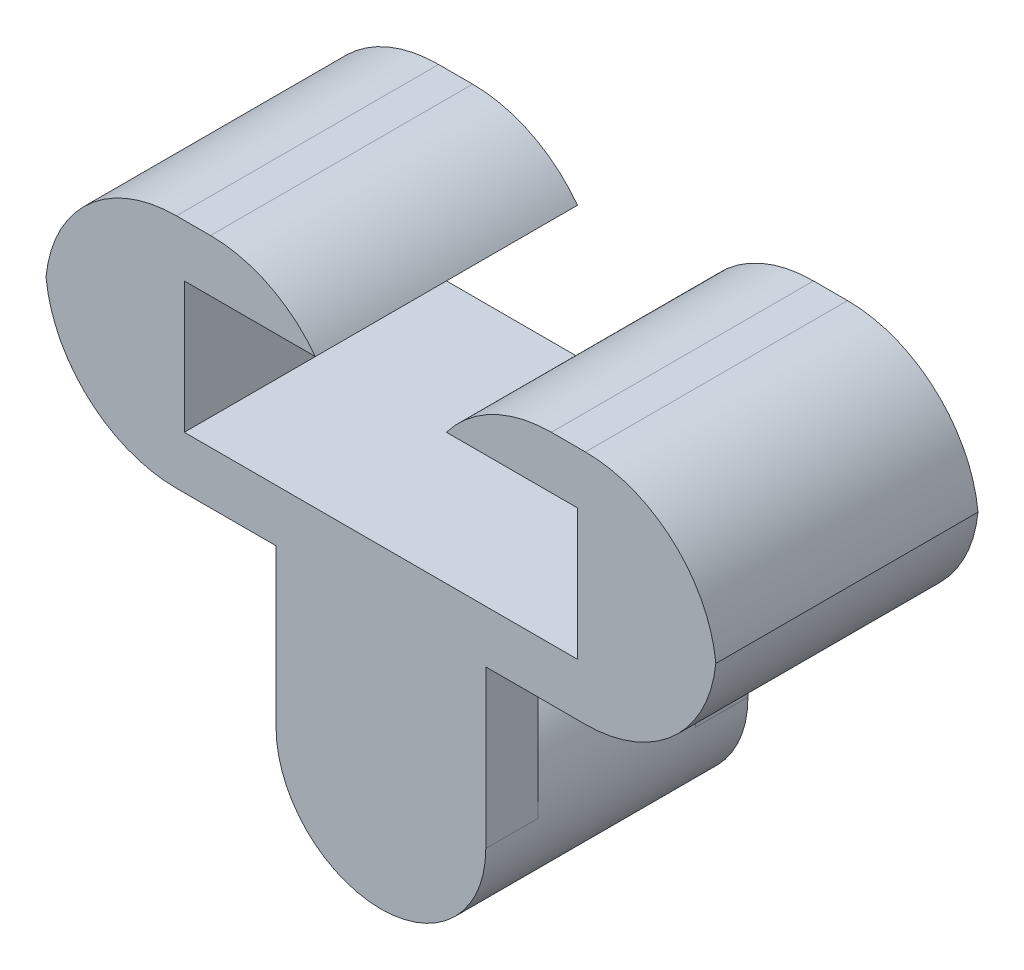
from build123d import *

# Parameters (mm, degrees)
BOSS_EXTRUDE2_DEPTH = 25.4
BOSS_EXTRUDE3_DEPTH = 7.62
SKETCH6_R           = 10.16
BOSS_EXTRUDE5_DEPTH = 25.4
FILLET4_R           = 12.7
CHAMFER3_SIZE       = 2.54
SKETCH7_W           = 20.32
SKETCH7_H           = 15.24
BOSS_EXTRUDE6_DEPTH = 7.62
CHAMFER4_SIZE       = 2.54


with BuildPart() as part:
    # Sketch2 → Boss-Extrude2 (new body)
    with BuildSketch(Plane.XY):
        Polygon((0, 0), (26.162, 0), (26.162, -5.08), (13.462, -5.08), (13.462, -17.78), (51.562, -17.78), (51.562, -5.08), (38.862, -5.08), (38.862, 0), (65.024, 0), (65.024, -22.86), (0, -22.86), align=None)
    extrude(amount=BOSS_EXTRUDE2_DEPTH)

    # Sketch4 → Boss-Extrude3 (add)
    with BuildSketch(Plane.XY.offset(25.4)):
        Polygon((32.512, -22.86), (22.352, -22.86), (22.352, -38.1), (42.672, -38.1), (42.672, -22.86), align=None)
    extrude(amount=-BOSS_EXTRUDE3_DEPTH)

    # Sketch6 → Boss-Extrude5 (add)
    with BuildSketch(Plane.XY.offset(25.4)):
        with Locations((32.512, -38.1)):
            Circle(SKETCH6_R)
    extrude(amount=-BOSS_EXTRUDE5_DEPTH)

    # Fillet4
    # the kernel refuses this fillet: 12.7 mm, written as the material it takes off along each edge
    with BuildSketch(Plane(origin=(65.024, -22.86, -31.75), x_dir=(-1, 0, 0), z_dir=(0, 0, 1)), Plane(origin=(0, -22.86, -31.75), x_dir=(0, 1, 0), z_dir=(0, 0, 1)), Plane(origin=(0, 0, -31.75), x_dir=(1, 0, 0), z_dir=(0, 0, 1))) as fillet4_piece_1:
        with BuildLine():
            CenterArc((FILLET4_R, -FILLET4_R), FILLET4_R, 90, 90)
            Line((0, -FILLET4_R), (-FILLET4_R * 0.02, -FILLET4_R))
            Line((-FILLET4_R * 0.02, -FILLET4_R), (-FILLET4_R * 0.02, FILLET4_R * 0.02))
            Line((-FILLET4_R * 0.02, FILLET4_R * 0.02), (FILLET4_R, FILLET4_R * 0.02))
            Line((FILLET4_R, FILLET4_R * 0.02), (FILLET4_R, 0))
        make_face()
    extrude(amount=88.9, mode=Mode.SUBTRACT)
    with BuildSketch(Plane(origin=(26.162, 0, -25.4), x_dir=(-1, 0, 0), z_dir=(0, 0, 1))) as fillet4_piece_2:
        with BuildLine():
            CenterArc((10.16, 12.7), FILLET4_R, 216.869897646, 53.130102354)
            Line((0, 5.08), (-0.2032, 4.9276))
            ThreePointArc((-0.2032, 4.9276), (-0.254, 2.54), (-0.254, 0))
            Line((-0.254, 0), (0, -0.254))
            Line((0, -0.254), (10.16, -0.254))
            Line((10.16, -0.254), (10.16, 0))
        make_face()
    extrude(amount=76.2, mode=Mode.SUBTRACT)
    with BuildSketch(Plane(origin=(38.862, 0, -25.4), x_dir=(0, -1, 0), z_dir=(0, 0, 1))) as fillet4_piece_3:
        with BuildLine():
            CenterArc((12.7, 10.16), FILLET4_R, 180, 53.130102354)
            Line((0, 10.16), (-0.254, 10.16))
            Line((-0.254, 10.16), (-0.254, 0))
            Line((-0.254, 0), (0, -0.254))
            ThreePointArc((0, -0.254), (2.54, -0.254), (4.9276, -0.2032))
            Line((4.9276, -0.2032), (5.08, 0))
        make_face()
    extrude(amount=76.2, mode=Mode.SUBTRACT)
    with BuildSketch(Plane(origin=(65.024, 0, -31.75), x_dir=(-1, 0, 0), z_dir=(0, 0, 1))) as fillet4_piece_4:
        with BuildLine():
            CenterArc((FILLET4_R, FILLET4_R), FILLET4_R, 180, 90)
            Line((0, FILLET4_R), (-FILLET4_R * 0.02, FILLET4_R))
            Line((-FILLET4_R * 0.02, FILLET4_R), (-FILLET4_R * 0.02, -FILLET4_R * 0.02))
            Line((-FILLET4_R * 0.02, -FILLET4_R * 0.02), (FILLET4_R, -FILLET4_R * 0.02))
            Line((FILLET4_R, -FILLET4_R * 0.02), (FILLET4_R, 0))
        make_face()
    extrude(amount=88.9, mode=Mode.SUBTRACT)

    # Chamfer3
    # the kernel refuses this chamfer: 2.54 mm, written as the material it takes off along each edge
    with BuildSketch(Plane(origin=(42.672, -44.632074789, 17.78), x_dir=(0.027495876610587302, 0, 0.9996219169112966), z_dir=(0, 1, 0))) as chamfer3_piece_1_section:
        Polygon((CHAMFER3_SIZE * 0.999621916911, -CHAMFER3_SIZE * 0.0274958766106), (-CHAMFER3_SIZE * 0.0274958766106, -CHAMFER3_SIZE * 0.999621916911), (0, 0), align=None)
    chamfer3_piece_1 = extrude(amount=21.772074789, mode=Mode.PRIVATE)
    chamfer3_piece_1 = chamfer3_piece_1 - Plane(origin=(32.512, -38.1, 18.664342035), x_dir=(1, 0, 0), z_dir=(0, 0, 1)) * Cylinder(10.16, 54, mode=Mode.PRIVATE)
    add(chamfer3_piece_1, mode=Mode.SUBTRACT)
    with BuildSketch(Plane(origin=(22.352, -22.86, 17.78), x_dir=(-0.02749587661058595, 0, 0.9996219169112968), z_dir=(0, -1, 0))) as chamfer3_piece_2_section:
        Polygon((CHAMFER3_SIZE * 0.999621916911, -CHAMFER3_SIZE * 0.0274958766106), (-CHAMFER3_SIZE * 0.0274958766106, -CHAMFER3_SIZE * 0.999621916911), (0, 0), align=None)
    chamfer3_piece_2 = extrude(amount=21.772074789, mode=Mode.PRIVATE)
    chamfer3_piece_2 = chamfer3_piece_2 - Plane(origin=(32.512, -38.1, 18.664342036), x_dir=(1, 0, 0), z_dir=(0, 0, 1)) * Cylinder(10.16, 54, mode=Mode.PRIVATE)
    add(chamfer3_piece_2, mode=Mode.SUBTRACT)

    # Sketch7 → Boss-Extrude6 (add)
    with BuildSketch(Plane(origin=(0, 0, 0), x_dir=(-1, 0, 0), z_dir=(0, 0, -1))):
        with Locations((-32.512, -30.48)):
            Rectangle(SKETCH7_W, SKETCH7_H)
    extrude(amount=-BOSS_EXTRUDE6_DEPTH)

    # Chamfer4
    # the kernel refuses this chamfer: 2.54 mm, written as the material it takes off along each edge
    with BuildSketch(Plane(origin=(22.352, -44.632074789, 7.62), x_dir=(0.9996219169112966, 0, 0.027495876610586282), z_dir=(0, 1, 0))) as chamfer4_piece_1_section:
        Polygon((CHAMFER4_SIZE * 0.999621916911, CHAMFER4_SIZE * 0.0274958766106), (-CHAMFER4_SIZE * 0.0274958766106, CHAMFER4_SIZE * 0.999621916911), (0, 0), align=None)
    chamfer4_piece_1 = extrude(amount=21.772074789, mode=Mode.PRIVATE)
    chamfer4_piece_1 = chamfer4_piece_1 - Plane(origin=(32.512, -38.1, 6.735657964), x_dir=(1, 0, 0), z_dir=(0, 0, 1)) * Cylinder(10.16, 54, mode=Mode.PRIVATE)
    add(chamfer4_piece_1, mode=Mode.SUBTRACT)
    with BuildSketch(Plane(origin=(42.672, -22.86, 7.62), x_dir=(0.027495876610587288, 0, -0.9996219169112968), z_dir=(0, -1, 0))) as chamfer4_piece_2_section:
        Polygon((CHAMFER4_SIZE * 0.999621916911, -CHAMFER4_SIZE * 0.0274958766106), (-CHAMFER4_SIZE * 0.0274958766106, -CHAMFER4_SIZE * 0.999621916911), (0, 0), align=None)
    chamfer4_piece_2 = extrude(amount=21.772074789, mode=Mode.PRIVATE)
    chamfer4_piece_2 = chamfer4_piece_2 - Plane(origin=(32.512, -38.1, 6.735657965), x_dir=(1, 0, 0), z_dir=(0, 0, 1)) * Cylinder(10.16, 54, mode=Mode.PRIVATE)
    add(chamfer4_piece_2, mode=Mode.SUBTRACT)


solid = part.part
